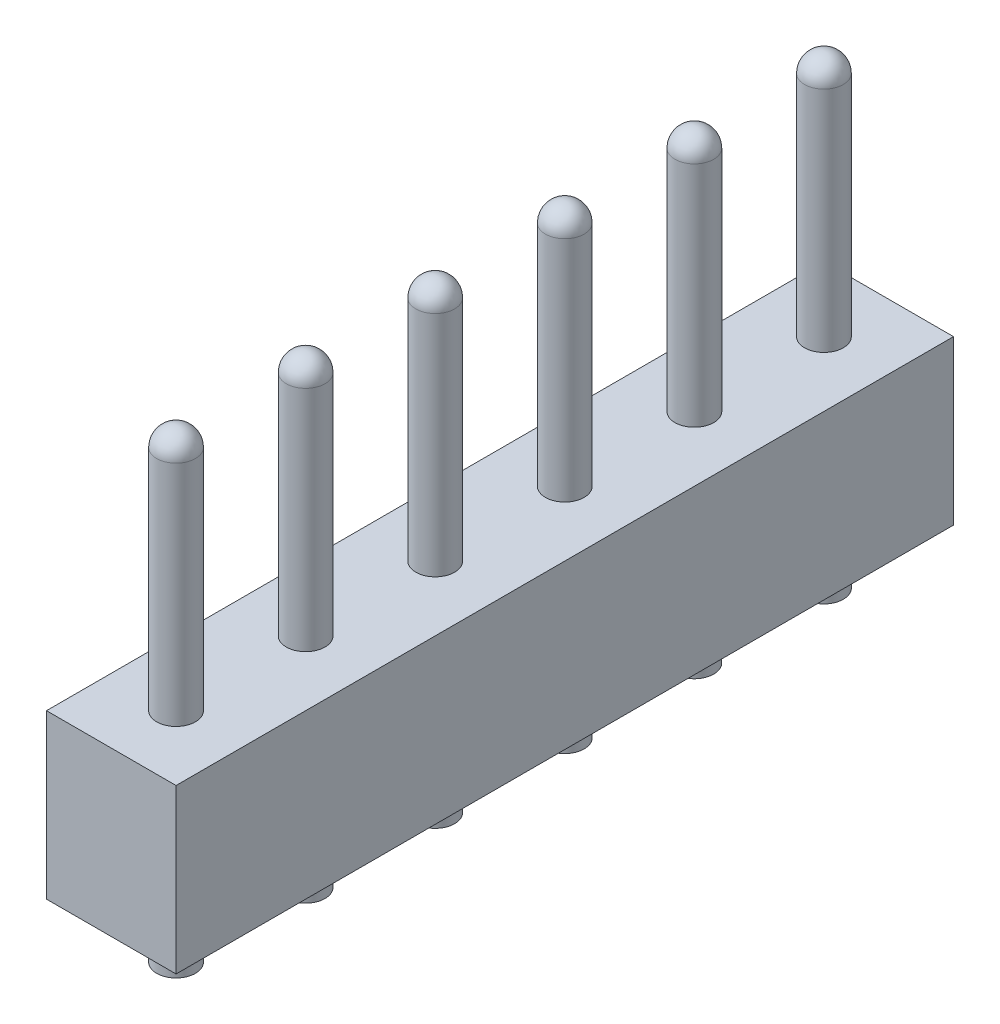
from build123d import *

# Parameters (mm, degrees)
SZKIC1_W                    = 2.54
SZKIC1_H                    = 2.54
DODANIE_WYCI_GNI_CIE1_DEPTH = 3.2
SZKIC2_R                    = 0.38
DODANIE_WYCI_GNI_CIE3_DEPTH = 4.47
OBR_T2_ANGLE                = 180
DODANIE_WYCI_GNI_CIE4_START = 1.07
SZKIC4_R                    = 0.38
DODANIE_WYCI_GNI_CIE4_DEPTH = 1.07
SZYK_LINIOWY1_COUNT         = 6
SZYK_LINIOWY1_PITCH         = 2.54


with BuildPart() as part:
    # Szkic1 → Dodanie-wyciągnięcie1 (new body)
    with BuildSketch(Plane(origin=(0, 0, 0), x_dir=(1, 0, 0), z_dir=(0, 1, 0))):
        Rectangle(SZKIC1_W, SZKIC1_H)
    dodanie_wyci_gni_cie1 = extrude(amount=DODANIE_WYCI_GNI_CIE1_DEPTH)

    # Szkic2 → Dodanie-wyciągnięcie3 (add)
    with BuildSketch(Plane(origin=(0, 3.2, 0), x_dir=(1, 0, 0), z_dir=(0, 1, 0))):
        Circle(SZKIC2_R)
    dodanie_wyci_gni_cie3 = extrude(amount=DODANIE_WYCI_GNI_CIE3_DEPTH)

    # Szkic3 → Obrót2 (revolve)
    with BuildSketch(Plane(origin=(0, 7.67, 0), x_dir=(1, 0, 0), z_dir=(0, 1, 0))):
        with BuildLine():
            Line((0, 0.38), (0, -0.38))
            ThreePointArc((0, -0.38), (-0.38, 0), (0, 0.38))
        make_face()
    obr_t2 = revolve(axis=Axis((0, 7.67, -0.38), (0, 0, -1)), revolution_arc=OBR_T2_ANGLE)

    # Szkic4 → Dodanie-wyciągnięcie4 (add)
    with BuildSketch(Plane.XZ.offset(DODANIE_WYCI_GNI_CIE4_START)):
        Circle(SZKIC4_R)
    dodanie_wyci_gni_cie4 = extrude(amount=-DODANIE_WYCI_GNI_CIE4_DEPTH)

    # Szyk liniowy1: Dodanie-wyciągnięcie1, Dodanie-wyciągnięcie3, Obrót2, Dodanie-wyciągnięcie4 ×6
    with Locations(*[(0, 0, -i * SZYK_LINIOWY1_PITCH) for i in range(1, SZYK_LINIOWY1_COUNT)]):
        add(dodanie_wyci_gni_cie1)
        add(dodanie_wyci_gni_cie3)
        add(obr_t2)
        add(dodanie_wyci_gni_cie4)


solid = part.part
